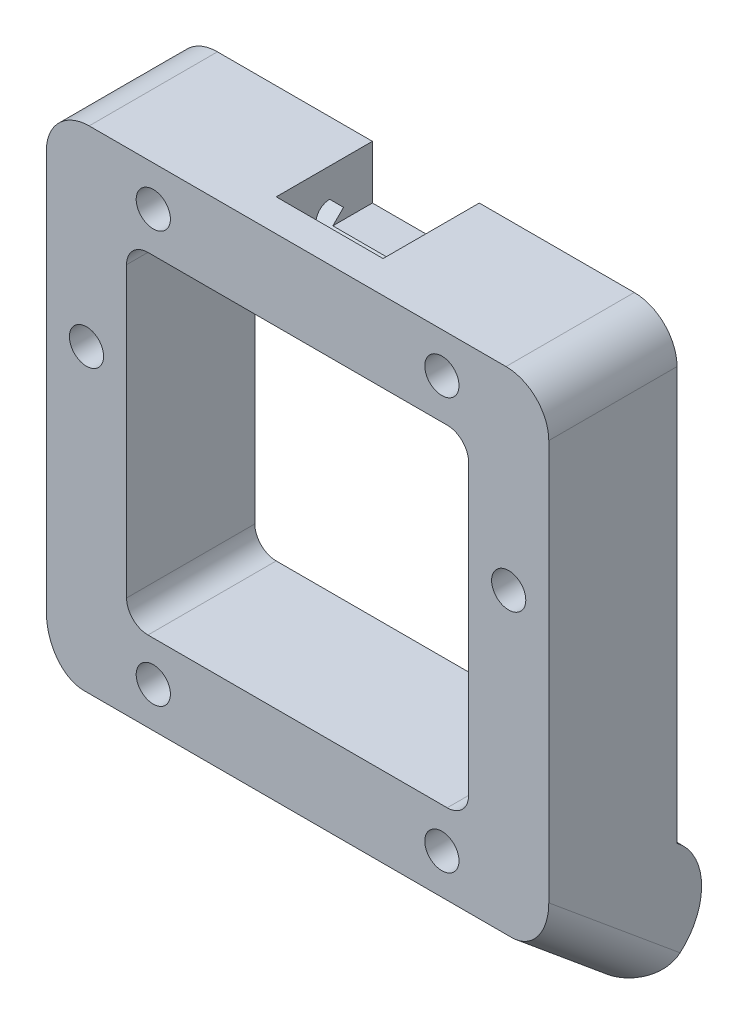
from build123d import *

# Parameters (mm, degrees)
BOSS_EXTRUDE1_DEPTH        = 12
CUT_EXTRUDE1_REACH         = 44.644
SKETCH3_R                  = 1.6
SKETCH6_W                  = 10
SKETCH6_H                  = 5
CUT_EXTRUDE3_DEPTH         = 9
CUT_EXTRUDE4_DEPTH         = 12.5
CUT_EXTRUDE5_START         = -23.5
CUT_EXTRUDE5_OUTLINE_R     = 3
CUT_EXTRUDE5_DEPTH         = 15.5
BOSS_EXTRUDE4_START        = -23.5
BOSS_EXTRUDE4_DEPTH        = 47
PIVOTSCREWHEADCUTOUT_START = -23.5
SKETCH10_R                 = 3
PIVOTSCREWHEADCUTOUT_DEPTH = 13
CUT_EXTRUDE2_START         = 8.5
SKETCH4_R                  = 3
CUT_EXTRUDE2_DEPTH         = 52.143874282
CUT_EXTRUDE10_START        = 10
SKETCH16_R                 = 3
CUT_EXTRUDE10_DEPTH        = 160.510325132
CUT_EXTRUDE7_START         = -23.5
CUT_EXTRUDE7_DEPTH         = 37
FILLET1_R                  = 3.5
CUT_EXTRUDE9_DEPTH         = 6.25


# Read off the part's stored shape, not the designer's step: Cut-Extrude5
with BuildPart() as part:
    # Sketch2 → Boss-Extrude1 (new body)
    with BuildSketch(Plane.XY):
        with BuildLine():
            Line((23.5, -8.75), (23.5, 29.5))
            ThreePointArc((23.5, 29.5), (22.328427125, 32.328427125), (19.5, 33.5))
            Line((19.5, 33.5), (-19.5, 33.5))
            ThreePointArc((-19.5, 33.5), (-22.328427125, 32.328427125), (-23.5, 29.5))
            Line((-23.5, 29.5), (-23.5, -8.75))
            Line((-23.5, -8.75), (-23.5, -12.5))
            Line((-23.5, -12.5), (-19.499997491, -12.5))
            Line((-19.499997491, -12.5), (19.531687848, -12.5))
            Line((19.531687848, -12.5), (23.5, -12.5))
            Line((23.5, -12.5), (23.5, -8.75))
        make_face()
        with BuildLine():
            Line((-16, -3), (-16, 24))
            ThreePointArc((-16, 24), (-15.414213562, 25.414213562), (-14, 26))
            Line((-14, 26), (14, 26))
            ThreePointArc((14, 26), (15.414213562, 25.414213562), (16, 24))
            Line((16, 24), (16, -3))
            ThreePointArc((16, -3), (15.414213562, -4.414213562), (14, -5))
            Line((14, -5), (-14, -5))
            ThreePointArc((-14, -5), (-15.414213562, -4.414213562), (-16, -3))
        make_face(mode=Mode.SUBTRACT)
    extrude(amount=BOSS_EXTRUDE1_DEPTH)

    # Sketch3 → Cut-Extrude1 (cut, up to next)
    with BuildSketch(Plane.XY, mode=Mode.PRIVATE) as cut_extrude1_sk1:
        with Locations((-13.5, 29.75)):
            Circle(SKETCH3_R)
    cut_extrude1_tool1 = extrude(cut_extrude1_sk1.sketch, amount=CUT_EXTRUDE1_REACH, mode=Mode.PRIVATE) & part.part
    # Sketch3 → Cut-Extrude1 (cut, up to next)
    with BuildSketch(Plane.XY, mode=Mode.PRIVATE) as cut_extrude1_sk2:
        with Locations((13.5, 29.75)):
            Circle(SKETCH3_R)
    cut_extrude1_tool2 = extrude(cut_extrude1_sk2.sketch, amount=CUT_EXTRUDE1_REACH, mode=Mode.PRIVATE) & part.part
    # Sketch3 → Cut-Extrude1 (cut, up to next)
    with BuildSketch(Plane.XY, mode=Mode.PRIVATE) as cut_extrude1_sk3:
        with Locations((19.75, 15.5)):
            Circle(SKETCH3_R)
    cut_extrude1_tool3 = extrude(cut_extrude1_sk3.sketch, amount=CUT_EXTRUDE1_REACH, mode=Mode.PRIVATE) & part.part
    # Sketch3 → Cut-Extrude1 (cut, up to next)
    with BuildSketch(Plane.XY, mode=Mode.PRIVATE) as cut_extrude1_sk4:
        with Locations((-19.75, 15.5)):
            Circle(SKETCH3_R)
    cut_extrude1_tool4 = extrude(cut_extrude1_sk4.sketch, amount=CUT_EXTRUDE1_REACH, mode=Mode.PRIVATE) & part.part
    # Sketch3 → Cut-Extrude1 (cut, up to next)
    with BuildSketch(Plane.XY, mode=Mode.PRIVATE) as cut_extrude1_sk5:
        with Locations((-13.5, -8.75)):
            Circle(SKETCH3_R)
    cut_extrude1_tool5 = extrude(cut_extrude1_sk5.sketch, amount=CUT_EXTRUDE1_REACH, mode=Mode.PRIVATE) & part.part
    # Sketch3 → Cut-Extrude1 (cut, up to next)
    with BuildSketch(Plane.XY, mode=Mode.PRIVATE) as cut_extrude1_sk6:
        with Locations((13.5, -8.75)):
            Circle(SKETCH3_R)
    cut_extrude1_tool6 = extrude(cut_extrude1_sk6.sketch, amount=CUT_EXTRUDE1_REACH, mode=Mode.PRIVATE) & part.part
    add(cut_extrude1_tool1.solids().sort_by_distance((-13.5, 29.75, 0))[0], mode=Mode.SUBTRACT)
    add(cut_extrude1_tool2.solids().sort_by_distance((13.5, 29.75, 0))[0], mode=Mode.SUBTRACT)
    add(cut_extrude1_tool3.solids().sort_by_distance((19.75, 15.5, 0))[0], mode=Mode.SUBTRACT)
    add(cut_extrude1_tool4.solids().sort_by_distance((-19.75, 15.5, 0))[0], mode=Mode.SUBTRACT)
    add(cut_extrude1_tool5.solids().sort_by_distance((-13.5, -8.75, 0))[0], mode=Mode.SUBTRACT)
    add(cut_extrude1_tool6.solids().sort_by_distance((13.5, -8.75, 0))[0], mode=Mode.SUBTRACT)

    # Sketch6 → Cut-Extrude3 (cut)
    with BuildSketch(Plane.XY):
        with Locations((0, 31)):
            Rectangle(SKETCH6_W, SKETCH6_H)
    extrude(amount=CUT_EXTRUDE3_DEPTH, mode=Mode.SUBTRACT)

    # Sketch7 → Cut-Extrude4 (cut, symmetric)
    with BuildSketch(Plane(origin=(0, 0, 0), x_dir=(0, 0, -1), z_dir=(1, 0, 0))):
        with BuildLine():
            Line((-4, 30.8), (-2.7, 29.5))
            Line((-2.7, 29.5), (-4, 28.2))
            ThreePointArc((-4, 28.2), (-5.3, 29.5), (-4, 30.8))
        make_face()
    extrude(amount=CUT_EXTRUDE4_DEPTH, both=True, mode=Mode.SUBTRACT)

    # Cut-Extrude5 outline → Cut-Extrude5 (cut)
    with BuildSketch(Plane(origin=(0, 0, 0), x_dir=(0, 0, -1), z_dir=(1, 0, 0)).offset(CUT_EXTRUDE5_START)):
        with Locations((-4, 29.5)):
            Circle(CUT_EXTRUDE5_OUTLINE_R)
    extrude(amount=CUT_EXTRUDE5_DEPTH, mode=Mode.SUBTRACT)

    # Sketch14 → Boss-Extrude4 (add)
    with BuildSketch(Plane(origin=(0, 0, 0), x_dir=(0, 0, -1), z_dir=(1, 0, 0)).offset(BOSS_EXTRUDE4_START)):
        with BuildLine():
            Line((-3.5, -19.55), (-12, -12.5))
            Line((-12, -12.5), (0, -12.5))
            Line((0, -12.5), (0, -9.125067568))
            ThreePointArc((0, -9.125067568), (1.998391042, -15.595994569), (-3.5, -19.55))
        make_face()
    extrude(amount=BOSS_EXTRUDE4_DEPTH)

    # Sketch10 → PivotScrewHeadCutout (cut)
    with BuildSketch(Plane(origin=(0, 0, 0), x_dir=(0, 0, -1), z_dir=(1, 0, 0)).offset(PIVOTSCREWHEADCUTOUT_START)):
        with Locations(Location((-3.5, -13.75, 0), (0, 0, 180))):
            Circle(SKETCH10_R)
    extrude(amount=PIVOTSCREWHEADCUTOUT_DEPTH, mode=Mode.SUBTRACT)

    # Sketch4 → Cut-Extrude2 (cut, through all)
    with BuildSketch(Plane.XY.offset(CUT_EXTRUDE2_START)):
        with Locations((-13.5, 29.75)):
            Circle(SKETCH4_R)
        with Locations((-13.5, -8.75)):
            Circle(SKETCH4_R)
    extrude(amount=-CUT_EXTRUDE2_DEPTH, mode=Mode.SUBTRACT)

    # Sketch16 → Cut-Extrude10 (cut, through all)
    with BuildSketch(Plane(origin=(67.926630299, -108.522644494, 12), x_dir=(-1, 0, 0), z_dir=(0, 0, -1)).offset(CUT_EXTRUDE10_START)):
        with Locations(Location((54.426630299, 138.272644494, 0), (0, 0, 180))):
            Circle(SKETCH16_R)
        with Locations(Location((87.676630299, 124.022644494, 0), (0, 0, 180))):
            Circle(SKETCH16_R)
        with Locations(Location((54.426630299, 99.772644494, 0), (0, 0, 187.18205644))):
            Circle(SKETCH16_R)
        with Locations(Location((48.176630299, 124.022644494, 0), (0, 0, 180))):
            Circle(SKETCH16_R)
    extrude(amount=CUT_EXTRUDE10_DEPTH, mode=Mode.SUBTRACT)

    # Sketch9 → Cut-Extrude7 (cut)
    with BuildSketch(Plane(origin=(0, 0, 0), x_dir=(0, 0, -1), z_dir=(1, 0, 0)).offset(CUT_EXTRUDE7_START)):
        with BuildLine():
            Line((-3.5, -12.45), (-2.2, -13.75))
            Line((-2.2, -13.75), (-3.5, -15.05))
            ThreePointArc((-3.5, -15.05), (-4.8, -13.75), (-3.5, -12.45))
        make_face()
    extrude(amount=CUT_EXTRUDE7_DEPTH, mode=Mode.SUBTRACT)

    # Fillet1
    # the kernel refuses this fillet: 3.5 mm, written as the material it takes off along each edge
    with BuildSketch(Plane(origin=(23.5, -25.136011381, -3.234907338), x_dir=(0, 0.769703695807885, -0.6384013006406574), z_dir=(0, 0.6384013006406574, 0.769703695807885)), Plane(origin=(-23.5, -25.136011381, -3.234907338), x_dir=(1, 0, 0), z_dir=(0, 0.6384013006406574, 0.769703695807885))) as fillet1_piece_1:
        with BuildLine():
            CenterArc((FILLET1_R, FILLET1_R), FILLET1_R, 180, 90)
            Line((0, FILLET1_R), (0, 0))
            Line((0, 0), (FILLET1_R, 0))
        make_face()
    extrude(amount=28.543210584, mode=Mode.SUBTRACT)

    # Sketch15 → Cut-Extrude9 (cut, symmetric)
    with BuildSketch(Plane(origin=(0, 0, 0), x_dir=(0, 0, -1), z_dir=(1, 0, 0))):
        with BuildLine():
            Line((-10.3, -13.75), (-10.3, -20.55))
            Line((-10.3, -20.55), (-3.5, -20.55))
            ThreePointArc((-3.5, -20.55), (1.308326112, -8.941673888), (-10.3, -13.75))
        make_face()
    extrude(amount=CUT_EXTRUDE9_DEPTH, both=True, mode=Mode.SUBTRACT)


solid = part.part
